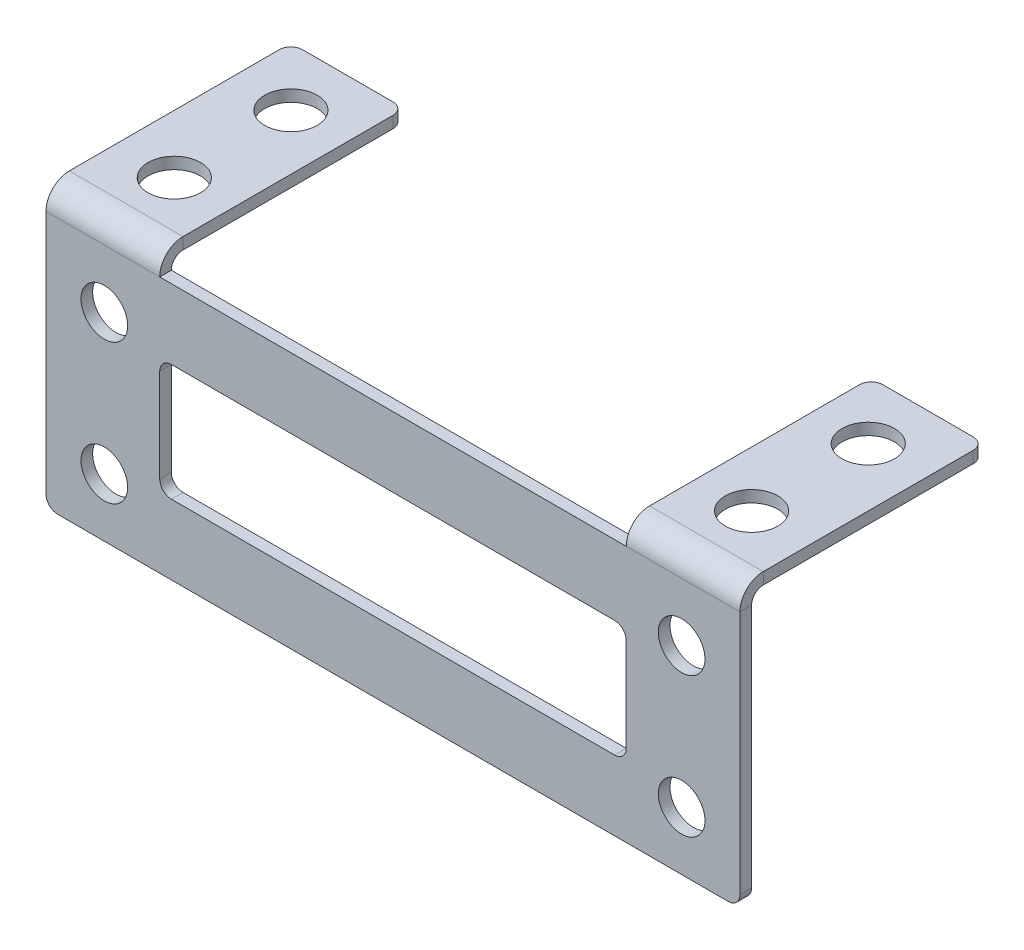
from build123d import *

# Parameters (mm, degrees)
SM_BASE_FLANGE_1_DEPTH  = 29.75
CUT_EXTRUDE_START       = -2
CUT_EXTRUDE_1_OUTLINE_W = 40
CUT_EXTRUDE_1_OUTLINE_H = 22
CUT_EXTRUDE_1_OUTLINE_R = 2.25
CUT_EXTRUDE_1_DEPTH     = 2
SKETCH_7_R              = 2
SKETCH_7_W              = 40
SKETCH_7_H              = 10
CUT_EXTRUDE_4_DEPTH     = 44.070436497
FILLET_1_R              = 1


# Read off the part's stored shape, not the designer's step: 切除-拉伸1
# Sheet-metal steps are written as plain solids
with BuildPart() as part:
    # Sketch 1 → 基体-法兰1 (new, symmetric)
    with BuildSketch(Plane.ZY):
        with BuildLine():
            Line((-20, 0), (-1, 0))
            ThreePointArc((-1, 0), (-0.292893219, -0.292893219), (0, -1))
            Line((0, -1), (0, -23))
            Line((0, -23), (1, -23))
            Line((1, -23), (1, -1))
            ThreePointArc((1, -1), (0.414213562, 0.414213562), (-1, 1))
            Line((-1, 1), (-20, 1))
            Line((-20, 1), (-20, 0))
        make_face()
    extrude(amount=SM_BASE_FLANGE_1_DEPTH, both=True)

    # 切除-拉伸1 outline → 切除-拉伸1 (cut)
    with BuildSketch(Plane(origin=(0, 1, 0), x_dir=(1, 0, 0), z_dir=(0, 1, 0)).offset(CUT_EXTRUDE_START)):
        with Locations((0, 9)):
            Rectangle(CUT_EXTRUDE_1_OUTLINE_W, CUT_EXTRUDE_1_OUTLINE_H)
        with Locations((-24.75, 15)):
            Circle(CUT_EXTRUDE_1_OUTLINE_R)
        with Locations((24.75, 15)):
            Circle(CUT_EXTRUDE_1_OUTLINE_R)
        with Locations((24.75, 5)):
            Circle(CUT_EXTRUDE_1_OUTLINE_R)
        with Locations((-24.75, 5)):
            Circle(CUT_EXTRUDE_1_OUTLINE_R)
    extrude(amount=CUT_EXTRUDE_1_DEPTH, mode=Mode.SUBTRACT)

    # 草图7 → 切除-拉伸4 (cut, through all)
    with BuildSketch(Plane.XY.offset(1)):
        with Locations((-24.75, -6)):
            Circle(SKETCH_7_R)
        with Locations((-24.75, -18)):
            Circle(SKETCH_7_R)
        with Locations((24.75, -18)):
            Circle(SKETCH_7_R)
        with Locations((24.75, -6)):
            Circle(SKETCH_7_R)
        with Locations((0, -12)):
            Rectangle(SKETCH_7_W, SKETCH_7_H)
    extrude(amount=-CUT_EXTRUDE_4_DEPTH, mode=Mode.SUBTRACT)

    # 圆角1
    fillet_1_edges = [part.edges().sort_by_distance(p)[0] for p in [
        (-20, -17, 0.5),
        (-20, -7, 0.5),
        (20, -7, 0.5),
        (20, -17, 0.5),
        (-29.75, 0.5, -20),
        (20, 0.5, -20),
        (-20, 0.5, -20),
        (-29.75, -23, 0.5),
        (29.75, 0.5, -20),
        (29.75, -23, 0.5),
    ]]
    fillet(fillet_1_edges, radius=FILLET_1_R)


solid = part.part
